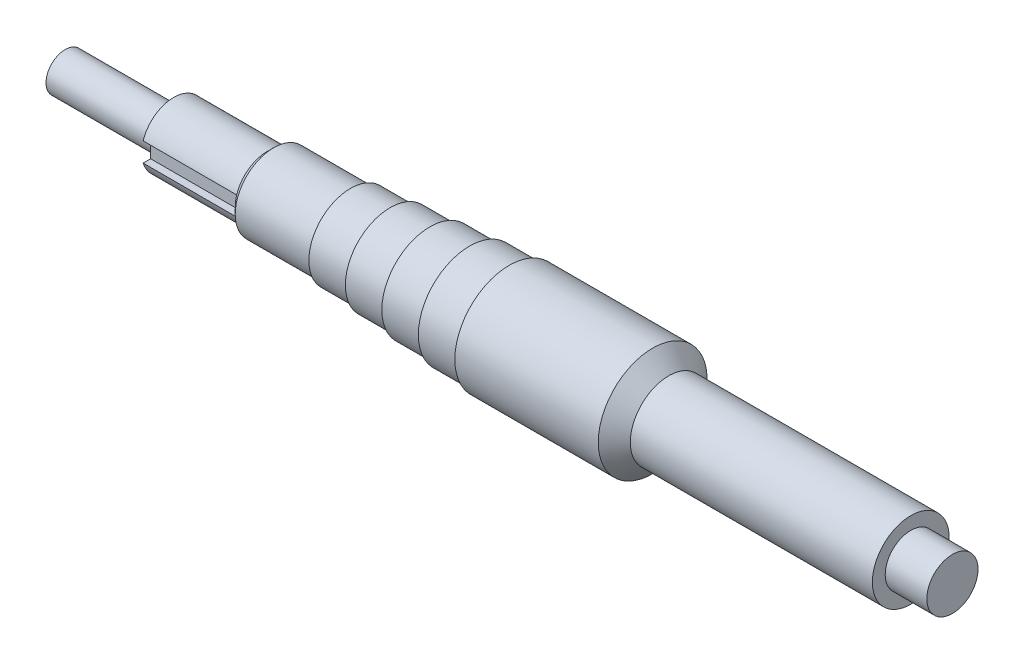
from build123d import *

# Parameters (mm, degrees)
CUT_EXTRUDE1_START = 2
SKETCH2_W          = 14.61
SKETCH2_H          = 3
CUT_EXTRUDE1_DEPTH = 1.4


with BuildPart() as part:
    # Sketch1 → Revolve1 (revolve)
    with BuildSketch(Plane.XY):
        Polygon((0, 0), (0, 3), (6.5, 3), (16.94, 3), (16.94, 5), (21.87, 5), (31.55, 5), (32.55, 6), (44.55, 6), (44.55, 6.5), (50.75, 6.5), (50.75, 7), (56.95, 7), (56.95, 7.5), (63.15, 7.5), (63.15, 8), (69.35, 8), (69.35, 8.5), (91.75, 8.5), (94.25, 6), (120.06, 6), (132.06, 6), (132.06, 4), (138.56, 4), (138.56, 0), align=None)
    revolve(axis=Axis((0, 0, 0), (1, 0, 0)))

    # Sketch2 → Cut-Extrude1 (cut)
    with BuildSketch(Plane.XY.offset(3).offset(CUT_EXTRUDE1_START)):
        with Locations((24.245, 0)):
            Rectangle(SKETCH2_W, SKETCH2_H)
    extrude(amount=-CUT_EXTRUDE1_DEPTH, mode=Mode.SUBTRACT)


solid = part.part
